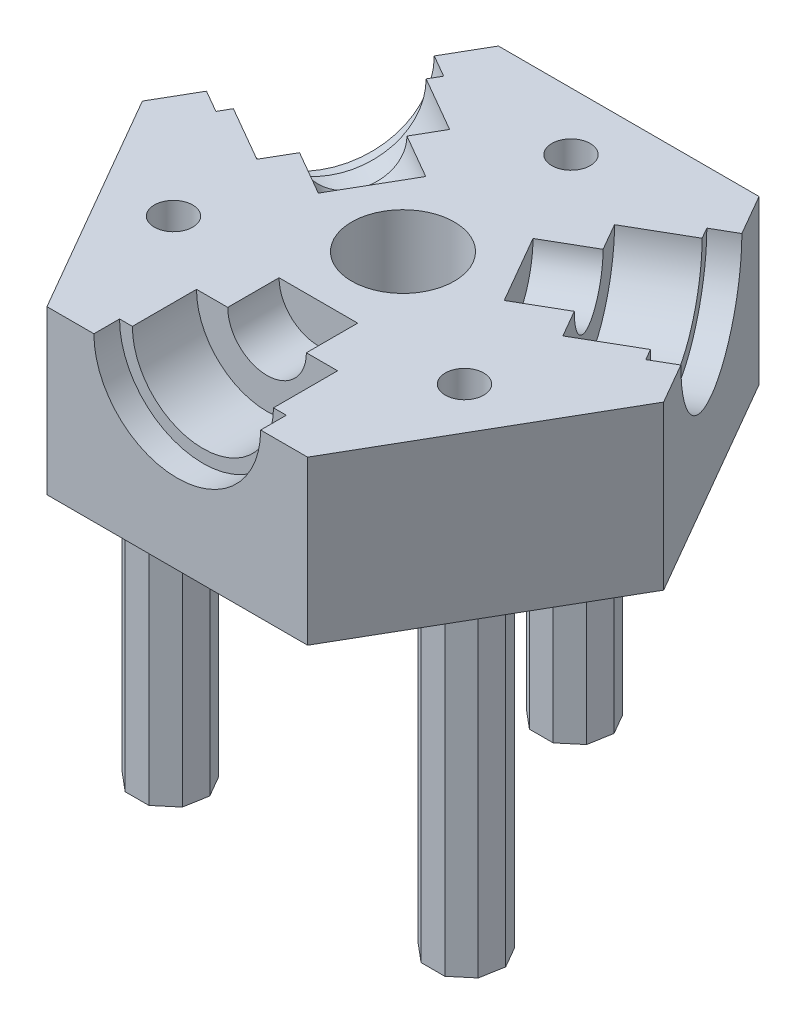
from build123d import *

# Parameters (mm, degrees)
BOSS_EXTRUDE1_DEPTH = 12.7
SKETCH2_R           = 5.5
SKETCH2_R_2         = 4
BOSS_EXTRUDE2_DEPTH = 3.499999906
CIRPATTERN1_COUNT   = 3
SKETCH6_R           = 4
CUT_EXTRUDE1_DEPTH  = 32.385015484
BOSS_EXTRUDE3_DEPTH = 25.4
RANDOM_CIRCLES_R    = 1.5
CUT_EXTRUDE2_DEPTH  = 2.54


with BuildPart() as part:
    # Sketch1 → Boss-Extrude1 (new body)
    with BuildSketch(Plane(origin=(0, 0, 0), x_dir=(1, 0, 0), z_dir=(0, 1, 0))):
        Polygon((10.16, -17.597636205), (20.32, 0), (10.16, 17.597636205), (-10.16, 17.597636205), (-20.32, 0), (-10.16, -17.597636205), align=None)
    extrude(amount=BOSS_EXTRUDE1_DEPTH)

    # Sketch2 → Boss-Extrude2 (add)
    with BuildSketch(Plane.XZ):
        Circle(SKETCH2_R)
        Circle(SKETCH2_R_2, mode=Mode.SUBTRACT)
    extrude(amount=BOSS_EXTRUDE2_DEPTH)

    # Sketch5 → Cut-Revolve1 (revolve, cut)
    with BuildSketch(Plane(origin=(0, 12.7, 0), x_dir=(1, 0, 0), z_dir=(0, 1, 0))):
        Polygon((0, -17.597636205), (0, -6.597636205), (-3.065310501, -6.597636205), (-3.065310501, -10.597636205), (-5.5, -10.597636205), (-5.5, -15.597636205), (-6.5, -15.597636205), (-6.5, -17.597636205), align=None)
    cut_revolve1 = revolve(axis=Axis((0, 12.7, 17.597636205), (0, 0, -1)), mode=Mode.SUBTRACT)

    # CirPattern1: Cut-Revolve1 ×3 about axis
    cirpattern1_axis = Axis((0, -3.499999906, 0), (0, 1, 0))
    for i in range(1, CIRPATTERN1_COUNT):
        add(cut_revolve1.rotate(cirpattern1_axis, i * 360 / CIRPATTERN1_COUNT), mode=Mode.SUBTRACT)

    # Sketch6 → Cut-Extrude1 (cut, through all)
    with BuildSketch(Plane(origin=(0, 12.7, 0), x_dir=(1, 0, 0), z_dir=(0, 1, 0))):
        Circle(SKETCH6_R)
    extrude(amount=-CUT_EXTRUDE1_DEPTH, mode=Mode.SUBTRACT)

    # Sketch8 → Boss-Extrude3 (add)
    with BuildSketch(Plane(origin=(0, 0, 0), x_dir=(1, 0, 0), z_dir=(0, 1, 0))):
        Polygon((-1.737462328, 15.3916171), (-2.661946723, 13.790363157), (-2.340876662, 11.969484358), (-0.924484395, 10.780990129), (0.924484395, 10.780990129), (2.340876662, 11.969484358), (2.661946723, 13.790363157), (1.737462328, 15.3916171), (0, 16.024001671), align=None)
        Polygon((14.198262578, -6.191122036), (13.273778183, -4.589868093), (11.536315855, -3.957483522), (9.798853527, -4.589868093), (8.874369132, -6.191122036), (9.195439193, -8.012000835), (10.61183146, -9.200495064), (12.46080025, -9.200495064), (13.877192517, -8.012000835), align=None)
        Polygon((-12.46080025, -9.200495064), (-10.61183146, -9.200495064), (-9.195439193, -8.012000835), (-8.874369132, -6.191122036), (-9.798853527, -4.589868093), (-11.536315855, -3.957483522), (-13.273778183, -4.589868093), (-14.198262578, -6.191122036), (-13.877192517, -8.012000835), align=None)
    extrude(amount=-BOSS_EXTRUDE3_DEPTH)

    # Random Circles → Cut-Extrude2 (cut)
    with BuildSketch(Plane(origin=(0, 12.7, 0), x_dir=(1, 0, 0), z_dir=(0, 1, 0))):
        with Locations((0, 13.097636205)):
            Circle(RANDOM_CIRCLES_R)
        with Locations((11.342882219, -6.548824102)):
            Circle(RANDOM_CIRCLES_R)
        with Locations((-11.342892611, -6.548818102)):
            Circle(RANDOM_CIRCLES_R)
    extrude(amount=-CUT_EXTRUDE2_DEPTH, mode=Mode.SUBTRACT)


solid = part.part
